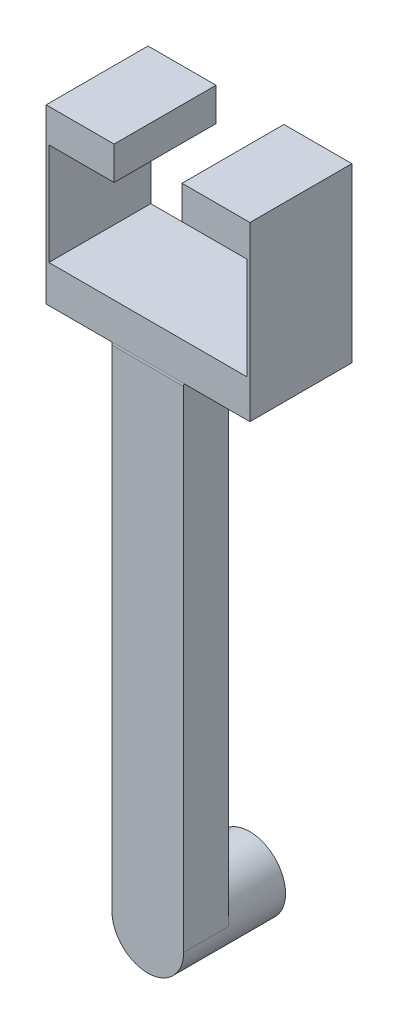
from build123d import *

# Parameters (mm, degrees)
SKETCH2_R           = 13.4112
BOSS_EXTRUDE1_DEPTH = 38.1
SKETCH5_W           = 26.8224
SKETCH5_H           = 184.15
BOSS_EXTRUDE2_DEPTH = 16.7386
SKETCH8_W           = 76.2
SKETCH8_H           = 38.1
BOSS_EXTRUDE3_DEPTH = 13.97
SKETCH9_W           = 1.016
SKETCH9_H           = 38.1
BOSS_EXTRUDE4_DEPTH = 38.1
SKETCH10_W          = 25.4
SKETCH10_H          = 38.1
BOSS_EXTRUDE5_DEPTH = 12.446
FILLET1_R           = 3.81


with BuildPart() as part:
    # Sketch2 → Boss-Extrude1 (new body)
    with BuildSketch(Plane.XY):
        with Locations(Location((0, 0, 0), (0, 0, 180))):
            Circle(SKETCH2_R)
    extrude(amount=BOSS_EXTRUDE1_DEPTH)

    # Sketch5 → Boss-Extrude2 (add)
    with BuildSketch(Plane.XY.offset(38.1)):
        with Locations((0, 92.075)):
            Rectangle(SKETCH5_W, SKETCH5_H)
    extrude(amount=-BOSS_EXTRUDE2_DEPTH)

    # Sketch8 → Boss-Extrude3 (add)
    with BuildSketch(Plane(origin=(0, 184.15, 0), x_dir=(1, 0, 0), z_dir=(0, 1, 0))):
        with Locations((0, -18.948214994)):
            Rectangle(SKETCH8_W, SKETCH8_H)
    extrude(amount=BOSS_EXTRUDE3_DEPTH)

    # Sketch9 → Boss-Extrude4 (add)
    with BuildSketch(Plane(origin=(0, 198.12, 0), x_dir=(1, 0, 0), z_dir=(0, 1, 0))):
        with Locations((-37.592, -18.948214994)):
            Rectangle(SKETCH9_W, SKETCH9_H)
        with Locations((37.592, -18.948214994)):
            Rectangle(SKETCH9_W, SKETCH9_H)
    extrude(amount=BOSS_EXTRUDE4_DEPTH)

    # Sketch10 → Boss-Extrude5 (add)
    with BuildSketch(Plane(origin=(0, 236.22, 0), x_dir=(1, 0, 0), z_dir=(0, 1, 0))):
        with Locations((-25.4, -18.948214994)):
            Rectangle(SKETCH10_W, SKETCH10_H)
        with Locations((25.4, -18.948214994)):
            Rectangle(SKETCH10_W, SKETCH10_H)
    extrude(amount=BOSS_EXTRUDE5_DEPTH)

    # Fillet1
    # the kernel refuses this fillet: 3.81 mm, written as the material it takes off along each edge
    with BuildSketch(Plane(origin=(15.598152153, 184.15, 38.1), x_dir=(0, 0, -1), z_dir=(-1, 0, 0))) as fillet1_piece_1:
        with BuildLine():
            CenterArc((3.81, 0.874780861), FILLET1_R, 180, 13.273598337)
            Line((0, 0.874780861), (-0.0762, 0.874780861))
            Line((-0.0762, 0.874780861), (-0.0762, 0))
            Line((-0.0762, 0), (0, -0.0762))
            ThreePointArc((0, -0.0762), (0.050892503, -0.0762), (0.027620706, -0.017495617))
            Line((0.027620706, -0.017495617), (0.101785006, 0))
        make_face()
    extrude(amount=31.196304306, mode=Mode.SUBTRACT)


solid = part.part
